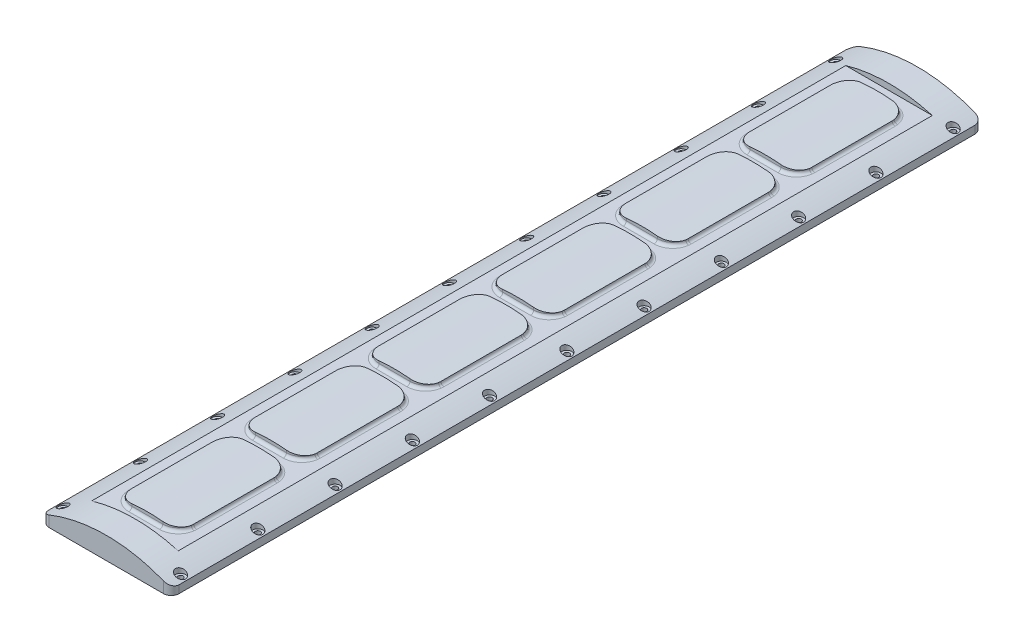
from build123d import *

# Parameters (mm, degrees)
BOSS_EXTRUDE1_DEPTH                           = 262.5
SKETCH2_W                                     = 8
SKETCH2_H                                     = 8
CUT_EXTRUDE1_DEPTH                            = 262.5
LPATTERN1_COUNT                               = 4
LPATTERN1_PITCH                               = 80
LPATTERN1_COUNT_DIR2                          = 4
LPATTERN1_PITCH_DIR2                          = 80
SKETCH3_W                                     = 8
SKETCH3_H                                     = 488
CUT_EXTRUDE2_DEPTH                            = 525
FILLET3_R                                     = 10
FILLET4_R                                     = 2
FILLET5_R                                     = 5
CBORE_FOR_M3_HEX_SOCKET_HEAD_CAP_SCR_2_COUNT  = 2
CBORE_FOR_M3_HEX_SOCKET_HEAD_CAP_SCR_2_PITCH  = 50
CBORE_FOR_M3_HEX_SOCKET_HEAD_CAP_SCR_3_COUNT  = 2
CBORE_FOR_M3_HEX_SOCKET_HEAD_CAP_SCR_3_PITCH  = 100
CBORE_FOR_M3_HEX_SOCKET_HEAD_CAP_SCR_4_COUNT  = 2
CBORE_FOR_M3_HEX_SOCKET_HEAD_CAP_SCR_4_PITCH  = 150
CBORE_FOR_M3_HEX_SOCKET_HEAD_CAP_SCR_5_COUNT  = 2
CBORE_FOR_M3_HEX_SOCKET_HEAD_CAP_SCR_5_PITCH  = 200
CBORE_FOR_M3_HEX_SOCKET_HEAD_CAP_SCR_6_COUNT  = 2
CBORE_FOR_M3_HEX_SOCKET_HEAD_CAP_SCR_6_PITCH  = 250
CBORE_FOR_M3_HEX_SOCKET_HEAD_CAP_SCR_7_COUNT  = 2
CBORE_FOR_M3_HEX_SOCKET_HEAD_CAP_SCR_7_PITCH  = 300
CBORE_FOR_M3_HEX_SOCKET_HEAD_CAP_SCR_8_COUNT  = 2
CBORE_FOR_M3_HEX_SOCKET_HEAD_CAP_SCR_8_PITCH  = 350
CBORE_FOR_M3_HEX_SOCKET_HEAD_CAP_SCR_9_COUNT  = 2
CBORE_FOR_M3_HEX_SOCKET_HEAD_CAP_SCR_9_PITCH  = 400
CBORE_FOR_M3_HEX_SOCKET_HEAD_CAP_SCR_10_COUNT = 2
CBORE_FOR_M3_HEX_SOCKET_HEAD_CAP_SCR_10_PITCH = 450
CBORE_FOR_M3_HEX_SOCKET_HEAD_CAP_SCR_11_COUNT = 2
CBORE_FOR_M3_HEX_SOCKET_HEAD_CAP_SCR_11_PITCH = 500
CBORE_FOR_M3_HEX_SOCKET_HEAD_CAP_SCR_12_COUNT = 2
CBORE_FOR_M3_HEX_SOCKET_HEAD_CAP_SCR_12_PITCH = 407.155989763
CBORE_FOR_M3_HEX_SOCKET_HEAD_CAP_SCR_13_COUNT = 2
CBORE_FOR_M3_HEX_SOCKET_HEAD_CAP_SCR_13_PITCH = 358.156390422
CBORE_FOR_M3_HEX_SOCKET_HEAD_CAP_SCR_14_COUNT = 2
CBORE_FOR_M3_HEX_SOCKET_HEAD_CAP_SCR_14_PITCH = 309.476978142
CBORE_FOR_M3_HEX_SOCKET_HEAD_CAP_SCR_15_COUNT = 2
CBORE_FOR_M3_HEX_SOCKET_HEAD_CAP_SCR_15_PITCH = 261.296766149
CBORE_FOR_M3_HEX_SOCKET_HEAD_CAP_SCR_16_COUNT = 2
CBORE_FOR_M3_HEX_SOCKET_HEAD_CAP_SCR_16_PITCH = 125.602547745
CBORE_FOR_M3_HEX_SOCKET_HEAD_CAP_SCR_17_COUNT = 2
CBORE_FOR_M3_HEX_SOCKET_HEAD_CAP_SCR_17_PITCH = 76
CBORE_FOR_M3_HEX_SOCKET_HEAD_CAP_SCR_18_COUNT = 2
CBORE_FOR_M3_HEX_SOCKET_HEAD_CAP_SCR_18_PITCH = 505.743017747
CBORE_FOR_M3_HEX_SOCKET_HEAD_CAP_SCR_19_COUNT = 2
CBORE_FOR_M3_HEX_SOCKET_HEAD_CAP_SCR_19_PITCH = 456.372654746
CBORE_FOR_M3_HEX_SOCKET_HEAD_CAP_SCR_20_COUNT = 2
CBORE_FOR_M3_HEX_SOCKET_HEAD_CAP_SCR_20_PITCH = 213.953265925
CBORE_FOR_M3_HEX_SOCKET_HEAD_CAP_SCR_21_COUNT = 2
CBORE_FOR_M3_HEX_SOCKET_HEAD_CAP_SCR_21_PITCH = 168.154690687
CBORE_FOR_M3_HEX_SOCKET_HEAD_CAP_SCR_22_COUNT = 2
CBORE_FOR_M3_HEX_SOCKET_HEAD_CAP_SCR_22_PITCH = 90.972523324


with BuildPart() as part:
    # Sketch1 → Boss-Extrude1 (new, symmetric)
    with BuildSketch(Plane.XY):
        with BuildLine():
            Line((-42, 5), (-42, 0))
            Line((-42, 0), (42, 0))
            Line((42, 0), (42, 5))
            ThreePointArc((42, 5), (0, 14.247589564), (-42, 5))
        make_face()
    extrude(amount=BOSS_EXTRUDE1_DEPTH, both=True)

    # Sketch2 → Cut-Extrude1 (cut, symmetric)
    with BuildSketch(Plane(origin=(0, 0, 0), x_dir=(0, 0, -1), z_dir=(1, 0, 0))):
        with Locations((0, 14.247589564)):
            Rectangle(SKETCH2_W, SKETCH2_H)
    cut_extrude1 = extrude(amount=CUT_EXTRUDE1_DEPTH, both=True, mode=Mode.SUBTRACT)

    # LPattern1: Cut-Extrude1 4 × 4
    with Locations(*[Vector(0, 0, -1) * (i * LPATTERN1_PITCH) + Vector(0, 0, 1) * (j * LPATTERN1_PITCH_DIR2) for i in range(LPATTERN1_COUNT) for j in range(LPATTERN1_COUNT_DIR2) if (i, j) != (0, 0)]):
        add(cut_extrude1, mode=Mode.SUBTRACT)

    # Sketch3 → Cut-Extrude2 (cut)
    with BuildSketch(Plane(origin=(0, 10.247589564, 0), x_dir=(1, 0, 0), z_dir=(0, 1, 0))):
        with Locations((-24, 0)):
            Rectangle(SKETCH3_W, SKETCH3_H)
        with Locations((24, 0)):
            Rectangle(SKETCH3_W, SKETCH3_H)
    extrude(amount=CUT_EXTRUDE2_DEPTH, mode=Mode.SUBTRACT)

    # Fillet3
    fillet3_edges = [part.edges().sort_by_distance(p)[0] for p in [
        (20, 11.237384419, -4),
        (-20, 11.237384419, -4),
        (-20, 11.237384419, 4),
        (20, 11.237384419, 4),
        (20, 11.237384419, -164),
        (20, 11.237384419, -156),
        (20, 11.237384419, -84),
        (20, 11.237384419, -76),
        (-20, 11.237384419, -164),
        (-20, 11.237384419, -156),
        (-20, 11.237384419, -84),
        (-20, 11.237384419, -76),
        (-20, 11.237384419, 76),
        (20, 11.237384419, -236),
        (-20, 11.237384419, -236),
        (20, 11.237384419, 76),
        (20, 11.237384419, 84),
        (-20, 11.237384419, 84),
        (-20, 11.237384419, 156),
        (20, 11.237384419, 156),
        (-20, 11.237384419, 236),
        (20, 11.237384419, 164),
        (-20, 11.237384419, 164),
        (20, 11.237384419, 236),
    ]]
    fillet(fillet3_edges, radius=FILLET3_R)

    # Fillet4
    fillet4_edges = [part.edges().sort_by_distance(p)[0] for p in [
        (17.071067812, 10.247589564, -166.928932188),
        (17.071067812, 10.247589564, -233.071067812),
        (0, 10.247589564, -236),
        (-17.071067812, 10.247589564, -233.071067812),
        (-17.071067812, 10.247589564, -166.928932188),
        (0, 10.247589564, -164),
        (17.071067812, 10.247589564, -86.928932188),
        (17.071067812, 10.247589564, -153.071067812),
        (0, 10.247589564, -156),
        (-17.071067812, 10.247589564, -153.071067812),
        (-17.071067812, 10.247589564, -86.928932188),
        (0, 10.247589564, -84),
        (17.071067812, 10.247589564, 233.071067812),
        (17.071067812, 10.247589564, 166.928932188),
        (0, 10.247589564, 164),
        (-17.071067812, 10.247589564, 166.928932188),
        (-17.071067812, 10.247589564, 233.071067812),
        (0, 10.247589564, 236),
        (17.071067812, 10.247589564, 86.928932188),
        (0, 10.247589564, 84),
        (-17.071067812, 10.247589564, 86.928932188),
        (-17.071067812, 10.247589564, 153.071067812),
        (0, 10.247589564, 156),
        (17.071067812, 10.247589564, 6.928932188),
        (0, 10.247589564, 4),
        (-17.071067812, 10.247589564, 6.928932188),
        (-17.071067812, 10.247589564, 73.071067812),
        (0, 10.247589564, 76),
        (17.071067812, 10.247589564, -6.928932188),
        (17.071067812, 10.247589564, -73.071067812),
        (0, 10.247589564, -76),
        (-17.071067812, 10.247589564, -73.071067812),
        (-17.071067812, 10.247589564, -6.928932188),
        (0, 10.247589564, -4),
        (17.071067812, 10.247589564, 73.071067812),
        (17.071067812, 10.247589564, 153.071067812),
    ]]
    fillet(fillet4_edges, radius=FILLET4_R)

    # Fillet5
    fillet5_edges = [part.edges().sort_by_distance(p)[0] for p in [
        (42, 2.5, -262.5),
        (-42, 2.5, 262.5),
        (-42, 2.5, -262.5),
        (42, 2.5, 262.5),
    ]]
    fillet(fillet5_edges, radius=FILLET5_R)

    # Sketch7 → CBORE for M3 Hex Socket Head Cap Screw1 (revolve, cut)
    with BuildSketch(Plane(origin=(38, 8, 252.5), x_dir=(0, 0, 1), z_dir=(1, 0, 0))):
        Polygon((0, 0), (0, 8), (1.7, 8), (1.7, 3.4), (3.25, 3.4), (3.25, 0), align=None)
    cbore_for_m3_hex_socket_head_cap_screw1 = revolve(axis=Axis((38, 14.35, 252.5), (0, -1, 0)), mode=Mode.SUBTRACT)

    # CBORE for M3 Hex Socket Head Cap Scr 2: CBORE for M3 Hex Socket Head Cap Screw1 ×2
    with Locations(*[(0, 0, -i * CBORE_FOR_M3_HEX_SOCKET_HEAD_CAP_SCR_2_PITCH) for i in range(1, CBORE_FOR_M3_HEX_SOCKET_HEAD_CAP_SCR_2_COUNT)]):
        add(cbore_for_m3_hex_socket_head_cap_screw1, mode=Mode.SUBTRACT)

    # CBORE for M3 Hex Socket Head Cap Scr 3: CBORE for M3 Hex Socket Head Cap Screw1 ×2
    with Locations(*[(0, 0, -i * CBORE_FOR_M3_HEX_SOCKET_HEAD_CAP_SCR_3_PITCH) for i in range(1, CBORE_FOR_M3_HEX_SOCKET_HEAD_CAP_SCR_3_COUNT)]):
        add(cbore_for_m3_hex_socket_head_cap_screw1, mode=Mode.SUBTRACT)

    # CBORE for M3 Hex Socket Head Cap Scr 4: CBORE for M3 Hex Socket Head Cap Screw1 ×2
    with Locations(*[(0, 0, -i * CBORE_FOR_M3_HEX_SOCKET_HEAD_CAP_SCR_4_PITCH) for i in range(1, CBORE_FOR_M3_HEX_SOCKET_HEAD_CAP_SCR_4_COUNT)]):
        add(cbore_for_m3_hex_socket_head_cap_screw1, mode=Mode.SUBTRACT)

    # CBORE for M3 Hex Socket Head Cap Scr 5: CBORE for M3 Hex Socket Head Cap Screw1 ×2
    with Locations(*[(0, 0, -i * CBORE_FOR_M3_HEX_SOCKET_HEAD_CAP_SCR_5_PITCH) for i in range(1, CBORE_FOR_M3_HEX_SOCKET_HEAD_CAP_SCR_5_COUNT)]):
        add(cbore_for_m3_hex_socket_head_cap_screw1, mode=Mode.SUBTRACT)

    # CBORE for M3 Hex Socket Head Cap Scr 6: CBORE for M3 Hex Socket Head Cap Screw1 ×2
    with Locations(*[(0, 0, -i * CBORE_FOR_M3_HEX_SOCKET_HEAD_CAP_SCR_6_PITCH) for i in range(1, CBORE_FOR_M3_HEX_SOCKET_HEAD_CAP_SCR_6_COUNT)]):
        add(cbore_for_m3_hex_socket_head_cap_screw1, mode=Mode.SUBTRACT)

    # CBORE for M3 Hex Socket Head Cap Scr 7: CBORE for M3 Hex Socket Head Cap Screw1 ×2
    with Locations(*[(0, 0, -i * CBORE_FOR_M3_HEX_SOCKET_HEAD_CAP_SCR_7_PITCH) for i in range(1, CBORE_FOR_M3_HEX_SOCKET_HEAD_CAP_SCR_7_COUNT)]):
        add(cbore_for_m3_hex_socket_head_cap_screw1, mode=Mode.SUBTRACT)

    # CBORE for M3 Hex Socket Head Cap Scr 8: CBORE for M3 Hex Socket Head Cap Screw1 ×2
    with Locations(*[(0, 0, -i * CBORE_FOR_M3_HEX_SOCKET_HEAD_CAP_SCR_8_PITCH) for i in range(1, CBORE_FOR_M3_HEX_SOCKET_HEAD_CAP_SCR_8_COUNT)]):
        add(cbore_for_m3_hex_socket_head_cap_screw1, mode=Mode.SUBTRACT)

    # CBORE for M3 Hex Socket Head Cap Scr 9: CBORE for M3 Hex Socket Head Cap Screw1 ×2
    with Locations(*[(0, 0, -i * CBORE_FOR_M3_HEX_SOCKET_HEAD_CAP_SCR_9_PITCH) for i in range(1, CBORE_FOR_M3_HEX_SOCKET_HEAD_CAP_SCR_9_COUNT)]):
        add(cbore_for_m3_hex_socket_head_cap_screw1, mode=Mode.SUBTRACT)

    # CBORE for M3 Hex Socket Head Cap Scr 10: CBORE for M3 Hex Socket Head Cap Screw1 ×2
    with Locations(*[(0, 0, -i * CBORE_FOR_M3_HEX_SOCKET_HEAD_CAP_SCR_10_PITCH) for i in range(1, CBORE_FOR_M3_HEX_SOCKET_HEAD_CAP_SCR_10_COUNT)]):
        add(cbore_for_m3_hex_socket_head_cap_screw1, mode=Mode.SUBTRACT)

    # CBORE for M3 Hex Socket Head Cap Scr 11: CBORE for M3 Hex Socket Head Cap Screw1 ×2
    with Locations(*[(0, 0, -i * CBORE_FOR_M3_HEX_SOCKET_HEAD_CAP_SCR_11_PITCH) for i in range(1, CBORE_FOR_M3_HEX_SOCKET_HEAD_CAP_SCR_11_COUNT)]):
        add(cbore_for_m3_hex_socket_head_cap_screw1, mode=Mode.SUBTRACT)

    # CBORE for M3 Hex Socket Head Cap Scr 12: CBORE for M3 Hex Socket Head Cap Screw1 ×2
    with Locations(*[Vector(-0.1866606458232702, 0, -0.982424451701422) * (i * CBORE_FOR_M3_HEX_SOCKET_HEAD_CAP_SCR_12_PITCH) for i in range(1, CBORE_FOR_M3_HEX_SOCKET_HEAD_CAP_SCR_12_COUNT)]):
        add(cbore_for_m3_hex_socket_head_cap_screw1, mode=Mode.SUBTRACT)

    # CBORE for M3 Hex Socket Head Cap Scr 13: CBORE for M3 Hex Socket Head Cap Screw1 ×2
    with Locations(*[Vector(-0.21219780529529828, 0, -0.9772267349125578) * (i * CBORE_FOR_M3_HEX_SOCKET_HEAD_CAP_SCR_13_PITCH) for i in range(1, CBORE_FOR_M3_HEX_SOCKET_HEAD_CAP_SCR_13_COUNT)]):
        add(cbore_for_m3_hex_socket_head_cap_screw1, mode=Mode.SUBTRACT)

    # CBORE for M3 Hex Socket Head Cap Scr 14: CBORE for M3 Hex Socket Head Cap Screw1 ×2
    with Locations(*[Vector(-0.24557561746996942, 0, -0.9693774373814584) * (i * CBORE_FOR_M3_HEX_SOCKET_HEAD_CAP_SCR_14_PITCH) for i in range(1, CBORE_FOR_M3_HEX_SOCKET_HEAD_CAP_SCR_14_COUNT)]):
        add(cbore_for_m3_hex_socket_head_cap_screw1, mode=Mode.SUBTRACT)

    # CBORE for M3 Hex Socket Head Cap Scr 15: CBORE for M3 Hex Socket Head Cap Screw1 ×2
    with Locations(*[Vector(-0.2908570248306122, 0, -0.9567665290480665) * (i * CBORE_FOR_M3_HEX_SOCKET_HEAD_CAP_SCR_15_PITCH) for i in range(1, CBORE_FOR_M3_HEX_SOCKET_HEAD_CAP_SCR_15_COUNT)]):
        add(cbore_for_m3_hex_socket_head_cap_screw1, mode=Mode.SUBTRACT)

    # CBORE for M3 Hex Socket Head Cap Scr 16: CBORE for M3 Hex Socket Head Cap Screw1 ×2
    with Locations(*[Vector(-0.6050832675335579, 0, -0.7961621941231025) * (i * CBORE_FOR_M3_HEX_SOCKET_HEAD_CAP_SCR_16_PITCH) for i in range(1, CBORE_FOR_M3_HEX_SOCKET_HEAD_CAP_SCR_16_COUNT)]):
        add(cbore_for_m3_hex_socket_head_cap_screw1, mode=Mode.SUBTRACT)

    # CBORE for M3 Hex Socket Head Cap Scr 17: CBORE for M3 Hex Socket Head Cap Screw1 ×2
    with Locations(*[(-i * CBORE_FOR_M3_HEX_SOCKET_HEAD_CAP_SCR_17_PITCH, 0, 0) for i in range(1, CBORE_FOR_M3_HEX_SOCKET_HEAD_CAP_SCR_17_COUNT)]):
        add(cbore_for_m3_hex_socket_head_cap_screw1, mode=Mode.SUBTRACT)

    # CBORE for M3 Hex Socket Head Cap Scr 18: CBORE for M3 Hex Socket Head Cap Screw1 ×2
    with Locations(*[Vector(-0.15027394809827288, 0, -0.9886443953833742) * (i * CBORE_FOR_M3_HEX_SOCKET_HEAD_CAP_SCR_18_PITCH) for i in range(1, CBORE_FOR_M3_HEX_SOCKET_HEAD_CAP_SCR_18_COUNT)]):
        add(cbore_for_m3_hex_socket_head_cap_screw1, mode=Mode.SUBTRACT)

    # CBORE for M3 Hex Socket Head Cap Scr 19: CBORE for M3 Hex Socket Head Cap Screw1 ×2
    with Locations(*[Vector(-0.16653057366524876, 0, -0.986036291438973) * (i * CBORE_FOR_M3_HEX_SOCKET_HEAD_CAP_SCR_19_PITCH) for i in range(1, CBORE_FOR_M3_HEX_SOCKET_HEAD_CAP_SCR_19_COUNT)]):
        add(cbore_for_m3_hex_socket_head_cap_screw1, mode=Mode.SUBTRACT)

    # CBORE for M3 Hex Socket Head Cap Scr 20: CBORE for M3 Hex Socket Head Cap Screw1 ×2
    with Locations(*[Vector(-0.35521776062357263, 0, -0.934783580588349) * (i * CBORE_FOR_M3_HEX_SOCKET_HEAD_CAP_SCR_20_PITCH) for i in range(1, CBORE_FOR_M3_HEX_SOCKET_HEAD_CAP_SCR_20_COUNT)]):
        add(cbore_for_m3_hex_socket_head_cap_screw1, mode=Mode.SUBTRACT)

    # CBORE for M3 Hex Socket Head Cap Scr 21: CBORE for M3 Hex Socket Head Cap Screw1 ×2
    with Locations(*[Vector(-0.45196479318866933, 0, -0.8920357760302685) * (i * CBORE_FOR_M3_HEX_SOCKET_HEAD_CAP_SCR_21_PITCH) for i in range(1, CBORE_FOR_M3_HEX_SOCKET_HEAD_CAP_SCR_21_COUNT)]):
        add(cbore_for_m3_hex_socket_head_cap_screw1, mode=Mode.SUBTRACT)

    # CBORE for M3 Hex Socket Head Cap Scr 22: CBORE for M3 Hex Socket Head Cap Screw1 ×2
    with Locations(*[Vector(-0.8354170822439402, 0, -0.5496165014762765) * (i * CBORE_FOR_M3_HEX_SOCKET_HEAD_CAP_SCR_22_PITCH) for i in range(1, CBORE_FOR_M3_HEX_SOCKET_HEAD_CAP_SCR_22_COUNT)]):
        add(cbore_for_m3_hex_socket_head_cap_screw1, mode=Mode.SUBTRACT)


solid = part.part
